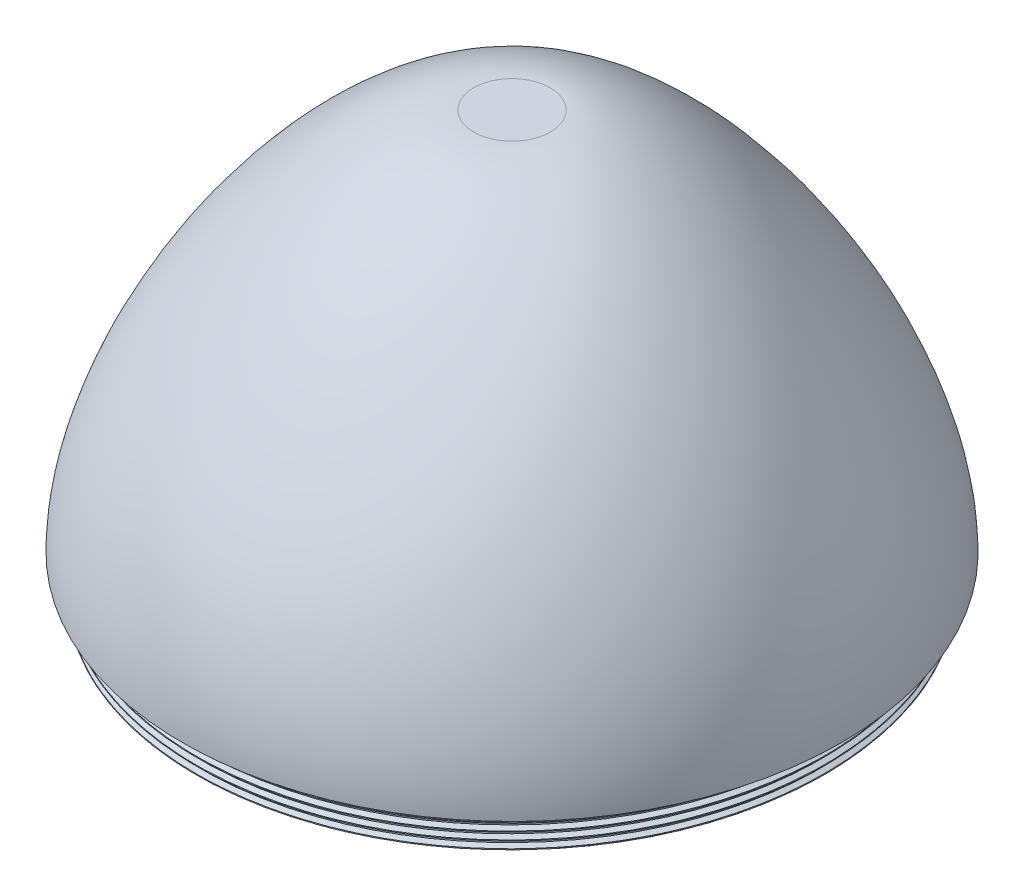
from build123d import *

# Parameters (mm, degrees)
THREAD2_PITCH = 1


with BuildPart() as part:
    # Sketch1 → Revolve1 (revolve)
    with BuildSketch(Plane.XY, mode=Mode.PRIVATE) as revolve1_sk:
        with BuildLine():
            Line((0, 50), (0, 40))
            add(Edge.make_bspline(
                [(0, 40), (33, 40), (33, 0)],
                knots=[0, 0, 0, 1, 1, 1], degree=2, weights=[1, 0.428571429, 1]))
            Line((33, 0), (33, -2.5))
            Line((33, -2.5), (35, -2.5))
            ThreePointArc((35, -2.5), (35.75, -1.75), (36.5, -2.5))
            Line((36.5, -2.5), (38, -2.5))
            Line((38, -2.5), (38, 0))
            Line((38, 0), (39, 0))
            Line((39, 0), (39, -5))
            Line((39, -5), (41, -5))
            Line((41, -5), (41, 0))
            Line((41, 0), (43, 0))
            add(Edge.make_bspline(
                [(5, 50), (43, 50), (43, 0)],
                knots=[0, 0, 0, 1, 1, 1], degree=2, weights=[1, 0.428571429, 1]))
            Line((5, 50), (0, 50))
        make_face()
    revolve(revolve1_sk.sketch.rotate(Axis((0, 40, 0), (0, -1, 0)), 180), axis=Axis((0, 40, 0), (0, -1, 0)))

    # Thread2: the profile of Thread Profile3 profile screwed along a right-hand helix of 5 turns, 8 arcs to a turn; built about Z, then put on its axis
    thread2_z = Axis((0, 0, 0), (0, 0, 1))
    thread2_corners = [(41.0003, 0, -0.000173205), (41.0003, 0, 0.875173202), (40.458734125, 0, 0.562499999), (40.458734125, 0, 0.312499999)]
    with BuildLine(mode=Mode.PRIVATE) as thread2_profile:
        Line(thread2_corners[0], thread2_corners[1])
        Line(thread2_corners[1], thread2_corners[2])
        Line(thread2_corners[2], thread2_corners[3])
        Line(thread2_corners[3], thread2_corners[0])
    thread2_cap = Face(thread2_profile.wire())
    thread2_turn_angles = [0, 22.5, 45, 67.5, 90, 112.5, 135, 157.5, 180, 202.5, 225, 247.5, 270, 292.5, 315, 337.5, 360]
    thread2_turn_weights = [1, 0.9238795325112867, 1, 0.9238795325112867, 1, 0.9238795325112867, 1, 0.9238795325112867, 1, 0.9238795325112867, 1, 0.9238795325112867, 1, 0.9238795325112867, 1, 0.9238795325112867, 1]
    thread2_turn_rails = [Edge.make_bspline([Vector(p[0], p[1], 0).rotate(thread2_z, thread2_turn_angles[k]) / thread2_turn_weights[k] + Vector(0, 0, p[2] + THREAD2_PITCH * thread2_turn_angles[k] / 360) for k in range(17)], [0, 0, 0, 1, 1, 2, 2, 3, 3, 4, 4, 5, 5, 6, 6, 7, 7, 8, 8, 8], 2, thread2_turn_weights) for p in thread2_corners]
    thread2_turn_sides = [Face.make_surface_from_curves(thread2_turn_rails[p[0]], thread2_turn_rails[p[1]]) for p in [(0, 1), (1, 2), (2, 3), (3, 0)]]
    thread2 = Plane(origin=(0, 0, 0), x_dir=(-1, 0, 0), z_dir=(0, -1, 0)) * Solid(Shell([*[p.moved(Location((0, 0, THREAD2_PITCH * i))) for i in range(5) for p in thread2_turn_sides], thread2_cap, thread2_cap.rotate(thread2_z, 1800).moved(Location((0, 0, THREAD2_PITCH * 1800 / 360)))]))
    add(thread2, mode=Mode.SUBTRACT)


solid = part.part
